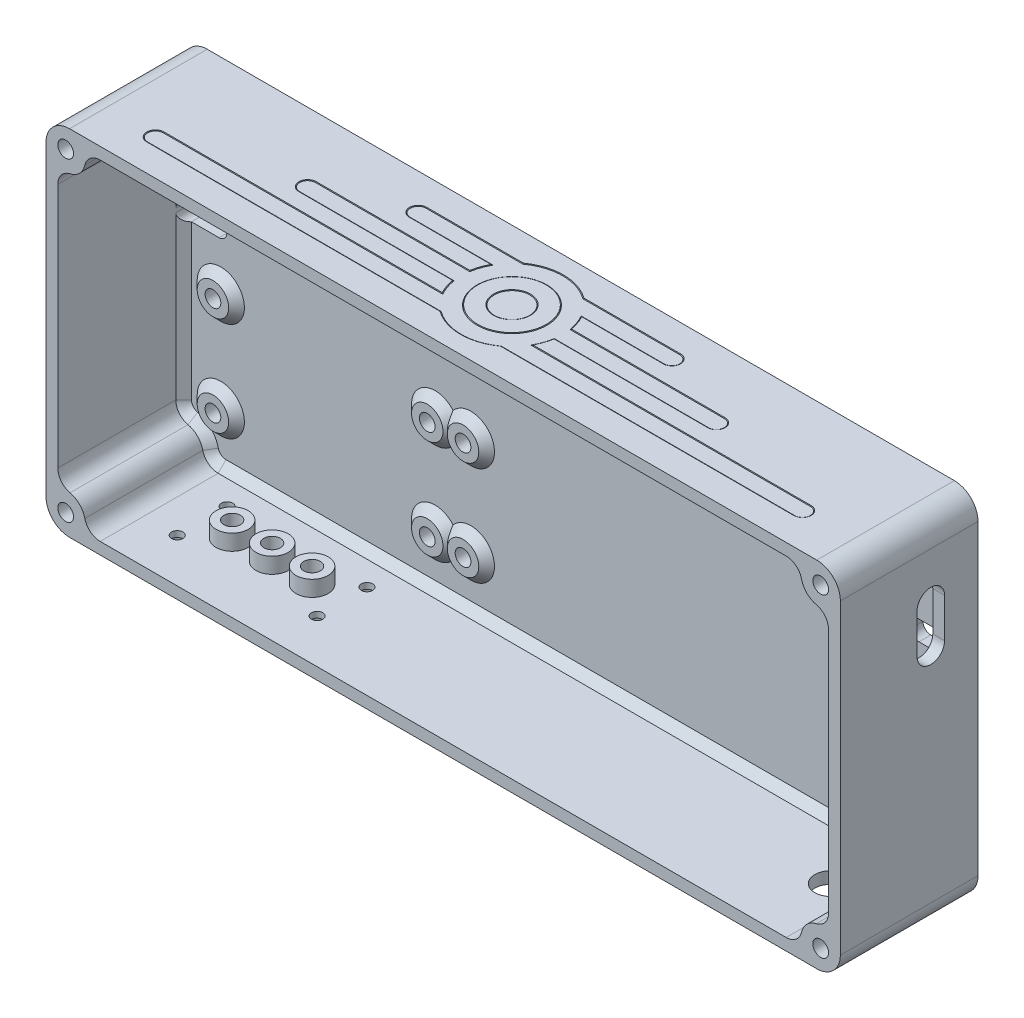
from build123d import *
from build123d.topology import SkipClean

# Parameters (mm, degrees)
ESQUISSE1_R                                        = 2
BOSS_EXTRU_1_DEPTH                                 = 35
COQUE1_T                                           = -3
ESQUISSE9_R                                        = 2
BOSS_EXTRU_3_DEPTH                                 = 25
ESQUISSE2_R                                        = 4
BOSS_EXTRU_2_DEPTH                                 = 2
ESQUISSE3_R                                        = 2
ENL_V_MAT_EXTRU_1_DEPTH                            = 115.568756649
ENL_V_MAT_EXTRU_2_REACH                            = 141.735
ESQUISSE4_R                                        = 4
ESQUISSE4_R_2                                      = 2.1
CHAMBRAGE_POUR_VIS_SIX_PANS_CREUX_M2_5_D           = 2.9
CHAMBRAGE_POUR_VIS_SIX_PANS_CREUX_M2_5_DEPTH       = 3
CHAMBRAGE_POUR_VIS_SIX_PANS_CREUX_M2_5_CBORE_D     = 5.5
CHAMBRAGE_POUR_VIS_SIX_PANS_CREUX_M2_5_CBORE_DEPTH = 1.5
ESQUISSE7_R                                        = 4.1
ESQUISSE7_R_2                                      = 2.1
EXTRU_MINCE1_DEPTH                                 = 4
CONG_1_R                                           = 4
CHANFREIN1_SIZE                                    = 2
ESQUISSE11_W                                       = 5.2
ESQUISSE11_H                                       = 5.2
ENL_V_MAT_EXTRU_5_DEPTH                            = 2.5
ESQUISSE8_W                                        = 11
ESQUISSE8_H                                        = 23
ESQUISSE8_W_2                                      = 196
ESQUISSE8_H_2                                      = 11
ENL_V_MAT_EXTRU_3_DEPTH                            = 2
ENL_V_MAT_EXTRU_4_REACH                            = 117.391
ESQUISSE10_W                                       = 11
ESQUISSE10_H                                       = 5
CONG_2_R                                           = 2
ESQUISSE15_R                                       = 4.7
ENL_V_MAT_EXTRU_7_DEPTH                            = 1.6
ESQUISSE16_R                                       = 8.9
BOSS_EXTRU_6_DEPTH                                 = 1.5
ESQUISSE16_R_2                                     = 4.5
BOSS_EXTRU_6_2_DEPTH                               = 1.5
ESQUISSE17_W                                       = 16.4
ESQUISSE17_H                                       = 16.4
ESQUISSE17_W_2                                     = 12.4
ESQUISSE17_H_2                                     = 12.4
ESQUISSE17_R                                       = 3.9
BOSS_EXTRU_7_DEPTH                                 = 2.3
BOSS_EXTRU_8_START                                 = 2.3
ESQUISSE17_3_W                                     = 16.4
ESQUISSE17_3_H                                     = 16.4
ESQUISSE17_3_W_2                                   = 12.4
ESQUISSE17_3_H_2                                   = 12.4
BOSS_EXTRU_8_DEPTH                                 = 3
ENL_V_START                                        = -1.4
ESQUISSE17_4_R                                     = 3.9
ENL_V_MAT_EXTRU_8_DEPTH                            = 1.4
ESQUISSE18_R                                       = 4.7
ENL_V_MAT_EXTRU_9_DEPTH                            = 2
CHANFREIN2_SIZE                                    = 5.3
BOSS_EXTRU_9_DEPTH                                 = 8.3
ENL_V_MAT_EXTRU_10_REACH                           = 123.416
ESQUISSE20_R                                       = 1
ENL_V_MAT_EXTRU_10_DIRECTION_2_REACH               = 123.416
ENL_V_MAT_EXTRU_11_DEPTH                           = 3


with BuildPart() as part:
    # Esquisse1 → Boss.-Extru.1 (new body)
    with BuildSketch(Plane.XY):
        with BuildLine():
            Line((-95, 45), (95, 45))
            ThreePointArc((95, 45), (99.242640687, 43.242640687), (101, 39))
            Line((101, 39), (101, -39))
            ThreePointArc((101, -39), (99.242640687, -43.242640687), (95, -45))
            Line((95, -45), (-95, -45))
            ThreePointArc((-95, -45), (-99.242640687, -43.242640687), (-101, -39))
            Line((-101, -39), (-101, 39))
            ThreePointArc((-101, 39), (-99.242640687, 43.242640687), (-95, 45))
        make_face()
        with Locations((-96, 40)):
            Circle(ESQUISSE1_R, mode=Mode.SUBTRACT)
        with Locations((-96, -40)):
            Circle(ESQUISSE1_R, mode=Mode.SUBTRACT)
        with Locations((96, 40)):
            Circle(ESQUISSE1_R, mode=Mode.SUBTRACT)
        with Locations((96, -40)):
            Circle(ESQUISSE1_R, mode=Mode.SUBTRACT)
    extrude(amount=BOSS_EXTRU_1_DEPTH)

    # Coque1
    coque1_openings = [part.faces().sort_by_distance(p)[0] for p in [
        (0, 0, 35),
    ]]
    offset(amount=COQUE1_T, openings=coque1_openings)

    # Esquisse9 → Boss.-Extru.3 (add)
    with BuildSketch(Plane(origin=(0, 0, 0), x_dir=(-1, 0, 0), z_dir=(0, 0, -1))):
        with Locations(Location((96, 40, 0), (0, 0, 180))):
            Circle(ESQUISSE9_R)
        with Locations(Location((96, -40, 0), (0, 0, 180))):
            Circle(ESQUISSE9_R)
        with Locations(Location((-96, -40, 0), (0, 0, 180))):
            Circle(ESQUISSE9_R)
        with Locations(Location((-96, 40, 0), (0, 0, 180))):
            Circle(ESQUISSE9_R)
    extrude(amount=-BOSS_EXTRU_3_DEPTH)

    # Esquisse2 → Boss.-Extru.2 (add)
    with BuildSketch(Plane.XY.offset(3)):
        with Locations((88.55, -29.4)):
            Circle(ESQUISSE2_R)
        with Locations((88.55, -4.2)):
            Circle(ESQUISSE2_R)
        with Locations((-24.95, -4.2)):
            Circle(ESQUISSE2_R)
        with Locations((-24.95, -29.4)):
            Circle(ESQUISSE2_R)
        with Locations((-34.05, -29.4)):
            Circle(ESQUISSE2_R)
        with Locations((-34.05, -4.2)):
            Circle(ESQUISSE2_R)
        with Locations((-88.55, -4.2)):
            Circle(ESQUISSE2_R)
        with Locations((-88.55, -29.4)):
            Circle(ESQUISSE2_R)
    extrude(amount=BOSS_EXTRU_2_DEPTH)

    # Esquisse3 → Enlèv. mat.-Extru.1 (cut, through all)
    with BuildSketch(Plane.XY.offset(5)):
        with Locations((88.55, -29.4)):
            Circle(ESQUISSE3_R)
        with Locations((88.55, -4.2)):
            Circle(ESQUISSE3_R)
        with Locations((-24.95, -4.2)):
            Circle(ESQUISSE3_R)
        with Locations((-24.95, -29.4)):
            Circle(ESQUISSE3_R)
        with Locations((-34.05, -29.4)):
            Circle(ESQUISSE3_R)
        with Locations((-88.55, -4.2)):
            Circle(ESQUISSE3_R)
        with Locations((-88.55, -29.4)):
            Circle(ESQUISSE3_R)
        with Locations((-34.05, -4.2)):
            Circle(ESQUISSE3_R)
    extrude(amount=-ENL_V_MAT_EXTRU_1_DEPTH, mode=Mode.SUBTRACT)

    # Esquisse4 → Enlèv. mat.-Extru.2 (cut, up to next)
    with BuildSketch(Plane.XZ.offset(45), mode=Mode.PRIVATE) as enl_v_mat_extru_2_sk1:
        with Locations(Location((81, 17.5, 0), (0, 0, 270))):
            Circle(ESQUISSE4_R)
    enl_v_mat_extru_2_tool1 = extrude(enl_v_mat_extru_2_sk1.sketch, amount=-ENL_V_MAT_EXTRU_2_REACH, mode=Mode.PRIVATE) & part.part
    # Esquisse4 → Enlèv. mat.-Extru.2 (cut, up to next)
    with BuildSketch(Plane.XZ.offset(45), mode=Mode.PRIVATE) as enl_v_mat_extru_2_sk2:
        with Locations(Location((-71.16, 17.5, 0), (0, 0, 270))):
            Circle(ESQUISSE4_R_2)
    enl_v_mat_extru_2_tool2 = extrude(enl_v_mat_extru_2_sk2.sketch, amount=-ENL_V_MAT_EXTRU_2_REACH, mode=Mode.PRIVATE) & part.part
    # Esquisse4 → Enlèv. mat.-Extru.2 (cut, up to next)
    with BuildSketch(Plane.XZ.offset(45), mode=Mode.PRIVATE) as enl_v_mat_extru_2_sk3:
        with Locations(Location((-61, 17.5, 0), (0, 0, 270))):
            Circle(ESQUISSE4_R_2)
    enl_v_mat_extru_2_tool3 = extrude(enl_v_mat_extru_2_sk3.sketch, amount=-ENL_V_MAT_EXTRU_2_REACH, mode=Mode.PRIVATE) & part.part
    # Esquisse4 → Enlèv. mat.-Extru.2 (cut, up to next)
    with BuildSketch(Plane.XZ.offset(45), mode=Mode.PRIVATE) as enl_v_mat_extru_2_sk4:
        with Locations(Location((-50.84, 17.5, 0), (0, 0, 270))):
            Circle(ESQUISSE4_R_2)
    enl_v_mat_extru_2_tool4 = extrude(enl_v_mat_extru_2_sk4.sketch, amount=-ENL_V_MAT_EXTRU_2_REACH, mode=Mode.PRIVATE) & part.part
    add(enl_v_mat_extru_2_tool1.solids().sort_by_distance((81, -45, 17.5))[0], mode=Mode.SUBTRACT)
    add(enl_v_mat_extru_2_tool2.solids().sort_by_distance((-71.16, -45, 17.5))[0], mode=Mode.SUBTRACT)
    add(enl_v_mat_extru_2_tool3.solids().sort_by_distance((-61, -45, 17.5))[0], mode=Mode.SUBTRACT)
    add(enl_v_mat_extru_2_tool4.solids().sort_by_distance((-50.84, -45, 17.5))[0], mode=Mode.SUBTRACT)

    # Chambrage pour vis à six pans creux M2.51
    with Locations(Plane(origin=(0, -45, 0), x_dir=(-1, 0, 0), z_dir=(0, -1, 0))):
        with Locations((78.78, -23.85), (78.78, -11.15), (43.22, -23.85), (43.22, -11.15)):
            CounterBoreHole(CHAMBRAGE_POUR_VIS_SIX_PANS_CREUX_M2_5_D / 2, CHAMBRAGE_POUR_VIS_SIX_PANS_CREUX_M2_5_CBORE_D / 2, CHAMBRAGE_POUR_VIS_SIX_PANS_CREUX_M2_5_CBORE_DEPTH, depth=CHAMBRAGE_POUR_VIS_SIX_PANS_CREUX_M2_5_DEPTH)

    # Esquisse7 → Extru.-Mince1 (add)
    # profile 1 of 3: a face of its own
    with SkipClean():  # the faces are left unmerged after this step: merging them gives an invalid solid
        with BuildSketch(Plane(origin=(0, -42, 0), x_dir=(1, 0, 0), z_dir=(0, 1, 0))):
            with Locations((-71.16, -17.5)):
                Circle(ESQUISSE7_R)
            with Locations((-71.16, -17.5)):
                Circle(ESQUISSE7_R_2, mode=Mode.SUBTRACT)
        # profile 2 of 3: a face of its own
        with BuildSketch(Plane(origin=(0, -42, 0), x_dir=(1, 0, 0), z_dir=(0, 1, 0))):
            with Locations((-61, -17.5)):
                Circle(ESQUISSE7_R)
            with Locations((-61, -17.5)):
                Circle(ESQUISSE7_R_2, mode=Mode.SUBTRACT)
        # profile 3 of 3: a face of its own
        with BuildSketch(Plane(origin=(0, -42, 0), x_dir=(1, 0, 0), z_dir=(0, 1, 0))):
            with Locations((-50.84, -17.5)):
                Circle(ESQUISSE7_R)
            with Locations((-50.84, -17.5)):
                Circle(ESQUISSE7_R_2, mode=Mode.SUBTRACT)
        extrude(amount=EXTRU_MINCE1_DEPTH)

    # Congé1
    cong_1_edges = [part.edges().sort_by_distance(p)[0] for p in [
        (98, 35.417424305, 19),
        (-91.417424305, 42, 19),
        (-98, -35.417424305, 19),
        (91.417424305, -42, 19),
        (-98, 35.417424305, 19),
        (-91.417424305, -42, 19),
        (91.417424305, 42, 19),
        (98, -35.417424305, 19),
    ]]
    fillet(cong_1_edges, radius=CONG_1_R)

    # Chanfrein1
    # the kernel refuses this chamfer: 2 mm, written as the material it adds along each edge
    with BuildSketch(Plane(origin=(-34.05, -4.2, 3), x_dir=(1, 0, 0), z_dir=(0, -1, 0))) as chanfrein1_piece_1_section:
        Polygon((4 + CHANFREIN1_SIZE, 0), (4, CHANFREIN1_SIZE), (4, 0), align=None)
    chanfrein1_piece_1 = revolve(axis=Axis((-34.05, -4.2, 3), (0, 0, 1)), mode=Mode.PRIVATE)
    chanfrein1_piece_1 = split(chanfrein1_piece_1, bisect_by=Plane(origin=(-39.049949525, -4.2, 5), z_dir=(0, 0, -1)), keep=Keep.TOP, mode=Mode.PRIVATE)
    add(chanfrein1_piece_1)
    with BuildSketch(Plane(origin=(-88.55, -4.2, 3), x_dir=(1, 0, 0), z_dir=(0, -1, 0))) as chanfrein1_piece_2_section:
        Polygon((4 + CHANFREIN1_SIZE, 0), (4, CHANFREIN1_SIZE), (4, 0), align=None)
    chanfrein1_piece_2 = revolve(axis=Axis((-88.55, -4.2, 3), (0, 0, 1)), mode=Mode.PRIVATE)
    chanfrein1_piece_2 = split(chanfrein1_piece_2, bisect_by=Plane(origin=(-93.549949528, -4.2, 5), z_dir=(0, 0, -1)), keep=Keep.TOP, mode=Mode.PRIVATE)
    add(chanfrein1_piece_2)
    with BuildSketch(Plane(origin=(-88.55, -29.4, 3), x_dir=(1, 0, 0), z_dir=(0, -1, 0))) as chanfrein1_piece_3_section:
        Polygon((4 + CHANFREIN1_SIZE, 0), (4, CHANFREIN1_SIZE), (4, 0), align=None)
    chanfrein1_piece_3 = revolve(axis=Axis((-88.55, -29.4, 3), (0, 0, 1)), mode=Mode.PRIVATE)
    chanfrein1_piece_3 = split(chanfrein1_piece_3, bisect_by=Plane(origin=(-93.549949525, -29.4, 5), z_dir=(0, 0, -1)), keep=Keep.TOP, mode=Mode.PRIVATE)
    add(chanfrein1_piece_3)
    with BuildSketch(Plane(origin=(-87.225035613, -42, 3), x_dir=(0, -0.027495876610585623, 0.9996219169112968), z_dir=(1, 0, 0)), Plane(origin=(87.225035613, 42, 3), x_dir=(0, 0.027495876610585623, 0.9996219169112968), z_dir=(-1, 0, 0))) as chanfrein1_piece_4:
        Polygon((CHANFREIN1_SIZE * 0.999621916911, -CHANFREIN1_SIZE * 0.0274958766106), (-CHANFREIN1_SIZE * 0.0274958766106, -CHANFREIN1_SIZE * 0.999621916911), (0, 0), align=None)
    extrude(amount=174.450071225)
    with BuildSketch(Plane(origin=(-96, -40, 3), x_dir=(0.974996043043569, 0.22222222222222282, 0), z_dir=(0.22222222222222282, -0.974996043043569, 0))) as chanfrein1_piece_5:
        Polygon((5, CHANFREIN1_SIZE), (5 + CHANFREIN1_SIZE, 0), (5, 0), align=None)
    revolve(axis=Axis((-96, -40, 3), (0, 0, 1)), revolution_arc=64.320823186)
    with BuildSketch(Plane(origin=(98, -31.225035613, 3), x_dir=(0.02749587661058907, 0, 0.9996219169112965), z_dir=(0, 1, 0)), Plane(origin=(-98, 31.225035613, 3), x_dir=(-0.02749587661058907, 0, 0.9996219169112965), z_dir=(0, -1, 0))) as chanfrein1_piece_6:
        Polygon((CHANFREIN1_SIZE * 0.999621916911, -CHANFREIN1_SIZE * 0.0274958766106), (-CHANFREIN1_SIZE * 0.0274958766106, -CHANFREIN1_SIZE * 0.999621916911), (0, 0), align=None)
    extrude(amount=62.450071225)
    with BuildSketch(Plane(origin=(96, 40, 3), x_dir=(-0.2222222222222174, -0.9749960430435702, 0), z_dir=(0.9749960430435702, -0.2222222222222174, 0))) as chanfrein1_piece_7:
        Polygon((5, -CHANFREIN1_SIZE), (5 + CHANFREIN1_SIZE, 0), (5, 0), align=None)
    revolve(axis=Axis((96, 40, 3), (0, 0, -1)), revolution_arc=64.320823186)
    with BuildSketch(Plane(origin=(-96, 40, 3), x_dir=(0.2222222222222285, -0.9749960430435676, 0), z_dir=(-0.9749960430435676, -0.2222222222222285, 0))) as chanfrein1_piece_8:
        Polygon((5, CHANFREIN1_SIZE), (5 + CHANFREIN1_SIZE, 0), (5, 0), align=None)
    revolve(axis=Axis((-96, 40, 3), (0, 0, 1)), revolution_arc=64.320823186)
    with BuildSketch(Plane(origin=(96, -40, 3), x_dir=(-0.9749960430435696, 0.2222222222222201, 0), z_dir=(-0.2222222222222201, -0.9749960430435696, 0))) as chanfrein1_piece_9:
        Polygon((5, -CHANFREIN1_SIZE), (5 + CHANFREIN1_SIZE, 0), (5, 0), align=None)
    revolve(axis=Axis((96, -40, 3), (0, 0, -1)), revolution_arc=64.320823186)
    with BuildSketch(Plane(origin=(-94, 31.225035613, 3), x_dir=(-0.2222222222222287, 0.9749960430435677, 0), z_dir=(0.9749960430435677, 0.2222222222222287, 0))) as chanfrein1_piece_10:
        Polygon((4, CHANFREIN1_SIZE), (4 - CHANFREIN1_SIZE, 0), (4, 0), align=None)
    revolve(axis=Axis((-94, 31.225035613, 3), (0, 0, 1)), revolution_arc=77.160411593)
    with BuildSketch(Plane(origin=(-87.225035613, 38, 3), x_dir=(0, 1, 0), z_dir=(1, 0, 0))) as chanfrein1_piece_11:
        Polygon((4, CHANFREIN1_SIZE), (4 - CHANFREIN1_SIZE, 0), (4, 0), align=None)
    revolve(axis=Axis((-87.225035613, 38, 3), (0, 0, 1)), revolution_arc=77.160411593)
    with BuildSketch(Plane(origin=(87.225035613, 38, 3), x_dir=(0.9749960430435685, 0.22222222222222512, 0), z_dir=(0.22222222222222512, -0.9749960430435685, 0))) as chanfrein1_piece_12:
        Polygon((4, CHANFREIN1_SIZE), (4 - CHANFREIN1_SIZE, 0), (4, 0), align=None)
    revolve(axis=Axis((87.225035613, 38, 3), (0, 0, 1)), revolution_arc=77.160411593)
    with BuildSketch(Plane(origin=(94, 31.225035613, 3), x_dir=(1, 0, 0), z_dir=(0, -1, 0))) as chanfrein1_piece_13:
        Polygon((4, CHANFREIN1_SIZE), (4 - CHANFREIN1_SIZE, 0), (4, 0), align=None)
    revolve(axis=Axis((94, 31.225035613, 3), (0, 0, 1)), revolution_arc=77.160411593)
    with BuildSketch(Plane(origin=(94, -31.225035613, 3), x_dir=(0.22222222222221782, -0.9749960430435702, 0), z_dir=(-0.9749960430435702, -0.22222222222221782, 0))) as chanfrein1_piece_14:
        Polygon((4, CHANFREIN1_SIZE), (4 - CHANFREIN1_SIZE, 0), (4, 0), align=None)
    revolve(axis=Axis((94, -31.225035613, 3), (0, 0, 1)), revolution_arc=77.160411593)
    with BuildSketch(Plane(origin=(87.225035613, -38, 3), x_dir=(0, -1, 0), z_dir=(-1, 0, 0))) as chanfrein1_piece_15:
        Polygon((4, CHANFREIN1_SIZE), (4 - CHANFREIN1_SIZE, 0), (4, 0), align=None)
    revolve(axis=Axis((87.225035613, -38, 3), (0, 0, 1)), revolution_arc=77.160411593)
    with BuildSketch(Plane(origin=(-94, -31.225035613, 3), x_dir=(-0.22222222222222834, -0.9749960430435678, 0), z_dir=(0.9749960430435678, -0.22222222222222834, 0))) as chanfrein1_piece_16:
        Polygon((4, -CHANFREIN1_SIZE), (4 - CHANFREIN1_SIZE, 0), (4, 0), align=None)
    revolve(axis=Axis((-94, -31.225035613, 3), (0, 0, -1)), revolution_arc=77.160411593)
    with BuildSketch(Plane(origin=(-87.225035613, -38, 3), x_dir=(-0.9749960430435689, -0.22222222222222346, 0), z_dir=(-0.22222222222222346, 0.9749960430435689, 0))) as chanfrein1_piece_17:
        Polygon((4, CHANFREIN1_SIZE), (4 - CHANFREIN1_SIZE, 0), (4, 0), align=None)
    revolve(axis=Axis((-87.225035613, -38, 3), (0, 0, 1)), revolution_arc=77.160411593)
    with BuildSketch(Plane(origin=(88.55, -4.2, 3), x_dir=(1, 0, 0), z_dir=(0, -1, 0))) as chanfrein1_piece_18_section:
        Polygon((4 + CHANFREIN1_SIZE, 0), (4, CHANFREIN1_SIZE), (4, 0), align=None)
    chanfrein1_piece_18 = revolve(axis=Axis((88.55, -4.2, 3), (0, 0, 1)), mode=Mode.PRIVATE)
    chanfrein1_piece_18 = split(chanfrein1_piece_18, bisect_by=Plane(origin=(83.550050474, -4.2, 5), z_dir=(0, 0, -1)), keep=Keep.TOP, mode=Mode.PRIVATE)
    add(chanfrein1_piece_18)
    with BuildSketch(Plane(origin=(-24.95, -4.2, 3), x_dir=(1, 0, 0), z_dir=(0, -1, 0))) as chanfrein1_piece_19_section:
        Polygon((4 + CHANFREIN1_SIZE, 0), (4, CHANFREIN1_SIZE), (4, 0), align=None)
    chanfrein1_piece_19 = revolve(axis=Axis((-24.95, -4.2, 3), (0, 0, 1)), mode=Mode.PRIVATE)
    chanfrein1_piece_19 = split(chanfrein1_piece_19, bisect_by=Plane(origin=(-29.949949525, -4.2, 5), z_dir=(0, 0, -1)), keep=Keep.TOP, mode=Mode.PRIVATE)
    add(chanfrein1_piece_19)
    with BuildSketch(Plane(origin=(-24.95, -29.4, 3), x_dir=(1, 0, 0), z_dir=(0, -1, 0))) as chanfrein1_piece_20_section:
        Polygon((4 + CHANFREIN1_SIZE, 0), (4, CHANFREIN1_SIZE), (4, 0), align=None)
    chanfrein1_piece_20 = revolve(axis=Axis((-24.95, -29.4, 3), (0, 0, 1)), mode=Mode.PRIVATE)
    chanfrein1_piece_20 = split(chanfrein1_piece_20, bisect_by=Plane(origin=(-29.949949525, -29.4, 5), z_dir=(0, 0, -1)), keep=Keep.TOP, mode=Mode.PRIVATE)
    add(chanfrein1_piece_20)
    with BuildSketch(Plane(origin=(88.55, -29.4, 3), x_dir=(1, 0, 0), z_dir=(0, -1, 0))) as chanfrein1_piece_21_section:
        Polygon((4 + CHANFREIN1_SIZE, 0), (4, CHANFREIN1_SIZE), (4, 0), align=None)
    chanfrein1_piece_21 = revolve(axis=Axis((88.55, -29.4, 3), (0, 0, 1)), mode=Mode.PRIVATE)
    chanfrein1_piece_21 = split(chanfrein1_piece_21, bisect_by=Plane(origin=(83.550050475, -29.4, 5), z_dir=(0, 0, -1)), keep=Keep.TOP, mode=Mode.PRIVATE)
    add(chanfrein1_piece_21)
    with BuildSketch(Plane(origin=(-34.05, -29.4, 3), x_dir=(1, 0, 0), z_dir=(0, -1, 0))) as chanfrein1_piece_22_section:
        Polygon((4 + CHANFREIN1_SIZE, 0), (4, CHANFREIN1_SIZE), (4, 0), align=None)
    chanfrein1_piece_22 = revolve(axis=Axis((-34.05, -29.4, 3), (0, 0, 1)), mode=Mode.PRIVATE)
    chanfrein1_piece_22 = split(chanfrein1_piece_22, bisect_by=Plane(origin=(-39.049949523, -29.4, 5), z_dir=(0, 0, -1)), keep=Keep.TOP, mode=Mode.PRIVATE)
    add(chanfrein1_piece_22)

    # Esquisse11 → Enlèv. mat.-Extru.5 (cut)
    with BuildSketch(Plane(origin=(0, 0, 0), x_dir=(-1, 0, 0), z_dir=(0, 0, -1))):
        with Locations((-81, 25)):
            Rectangle(ESQUISSE11_W, ESQUISSE11_H)
        with Locations((-81, -25)):
            Rectangle(ESQUISSE11_W, ESQUISSE11_H)
        with Locations((81, -25)):
            Rectangle(ESQUISSE11_W, ESQUISSE11_H)
        with Locations((81, 25)):
            Rectangle(ESQUISSE11_W, ESQUISSE11_H)
    extrude(amount=-ENL_V_MAT_EXTRU_5_DEPTH, mode=Mode.SUBTRACT)

    # Esquisse8 → Enlèv. mat.-Extru.3 (cut)
    with BuildSketch(Plane(origin=(0, 0, 0), x_dir=(-1, 0, 0), z_dir=(0, 0, -1))):
        with Locations((-92.5, 19.5)):
            Rectangle(ESQUISSE8_W, ESQUISSE8_H)
        with Locations((0, 36.5)):
            Rectangle(ESQUISSE8_W_2, ESQUISSE8_H_2)
        with Locations((92.5, 19.5)):
            Rectangle(ESQUISSE8_W, ESQUISSE8_H)
    extrude(amount=-ENL_V_MAT_EXTRU_3_DEPTH, mode=Mode.SUBTRACT)

    # Esquisse10 → Enlèv. mat.-Extru.4 (cut, up to next)
    with BuildSketch(Plane(origin=(0, 0, 2), x_dir=(-1, 0, 0), z_dir=(0, 0, -1)), mode=Mode.PRIVATE) as enl_v_mat_extru_4_sk1:
        with Locations((-92.5, 10.5)):
            Rectangle(ESQUISSE10_W, ESQUISSE10_H)
    enl_v_mat_extru_4_tool1 = extrude(enl_v_mat_extru_4_sk1.sketch, amount=-ENL_V_MAT_EXTRU_4_REACH, mode=Mode.PRIVATE) & part.part
    # Esquisse10 → Enlèv. mat.-Extru.4 (cut, up to next)
    with BuildSketch(Plane(origin=(0, 0, 2), x_dir=(-1, 0, 0), z_dir=(0, 0, -1)), mode=Mode.PRIVATE) as enl_v_mat_extru_4_sk2:
        with Locations((92.5, 10.5)):
            Rectangle(ESQUISSE10_W, ESQUISSE10_H)
    enl_v_mat_extru_4_tool2 = extrude(enl_v_mat_extru_4_sk2.sketch, amount=-ENL_V_MAT_EXTRU_4_REACH, mode=Mode.PRIVATE) & part.part
    add(enl_v_mat_extru_4_tool1.solids().sort_by_distance((92.5, 10.5, 2))[0], mode=Mode.SUBTRACT)
    add(enl_v_mat_extru_4_tool2.solids().sort_by_distance((-92.5, 10.5, 2))[0], mode=Mode.SUBTRACT)

    # Congé2
    cong_2_edges = [part.edges().sort_by_distance(p)[0] for p in [
        (-98, 8, 2.5),
        (-98, 13, 3.5),
        (-87, 13, 2.5),
        (-87, 8, 1.5),
        (-87, 31, 1),
        (-98, 42, 1),
        (98, 8, 2.5),
        (98, 13, 3.5),
        (87, 13, 2.5),
        (98, 42, 1),
        (87, 8, 1.5),
        (87, 31, 1),
    ]]
    fillet(cong_2_edges, radius=CONG_2_R)

    # Esquisse15 → Enlèv. mat.-Extru.7 (cut)
    with BuildSketch(Plane(origin=(0, 45, 0), x_dir=(1, 0, 0), z_dir=(0, 1, 0))):
        with BuildLine():
            Line((-2.264950331, -28.1), (-7.697402159, -28.1))
            ThreePointArc((-7.697402159, -28.1), (5.948698669, -29.17146024), (13.1, -17.5))
            ThreePointArc((13.1, -17.5), (5.948698669, -5.82853976), (-7.697402159, -6.9))
            Line((-7.697402159, -6.9), (-2.264950331, -6.9))
            ThreePointArc((-2.264950331, -6.9), (-0.819107483, -7.44182677), (-0.085443145, -8.800419581))
            ThreePointArc((-0.085443145, -8.800419581), (6.121545746, -11.318036098), (8.7, -17.5))
            ThreePointArc((8.7, -17.5), (6.121545746, -23.681963902), (-0.085443145, -26.199580419))
            ThreePointArc((-0.085443145, -26.199580419), (-0.819107483, -27.55817323), (-2.264950331, -28.1))
        make_face()
        with BuildLine():
            Line((-6.103277808, -23.7), (-11.539930676, -23.7))
            ThreePointArc((-11.539930676, -23.7), (-9.867053443, -26.11691687), (-7.697402159, -28.1))
            Line((-7.697402159, -28.1), (-2.264950331, -28.1))
            ThreePointArc((-2.264950331, -28.1), (-0.819107483, -27.55817323), (-0.085443145, -26.199580419))
            ThreePointArc((-0.085443145, -26.199580419), (-3.337220749, -25.534485526), (-6.103277808, -23.7))
        make_face()
        with BuildLine():
            ThreePointArc((-7.697402159, -28.1), (-9.867053443, -26.11691687), (-11.539930676, -23.7))
            Line((-11.539930676, -23.7), (-82.264950331, -23.7))
            ThreePointArc((-82.264950331, -23.7), (-84.464950331, -25.9), (-82.264950331, -28.1))
            Line((-82.264950331, -28.1), (-7.697402159, -28.1))
        make_face()
        with BuildLine():
            ThreePointArc((-8.42183908, -19.682344268), (-8.560639656, -19.69558163), (-8.7, -19.7))
            Line((-8.7, -19.7), (-12.91394595, -19.7))
            ThreePointArc((-12.91394595, -19.7), (-12.389431807, -21.755817136), (-11.539930676, -23.7))
            Line((-11.539930676, -23.7), (-6.103277808, -23.7))
            ThreePointArc((-6.103277808, -23.7), (-7.535260085, -21.84854636), (-8.42183908, -19.682344268))
        make_face()
        with BuildLine():
            Line((-51.978521026, -19.7), (-12.91394595, -19.7))
            ThreePointArc((-12.91394595, -19.7), (-13.1, -17.5), (-12.91394595, -15.3))
            Line((-12.91394595, -15.3), (-51.978521026, -15.3))
            ThreePointArc((-51.978521026, -15.3), (-54.178521026, -17.5), (-51.978521026, -19.7))
        make_face()
        with BuildLine():
            Line((-12.91394595, -19.7), (-8.7, -19.7))
            ThreePointArc((-8.7, -19.7), (-8.560639656, -19.69558163), (-8.42183908, -19.682344268))
            ThreePointArc((-8.42183908, -19.682344268), (-8.7, -17.5), (-8.42183908, -15.317655732))
            ThreePointArc((-8.42183908, -15.317655732), (-8.560639656, -15.30441837), (-8.7, -15.3))
            Line((-8.7, -15.3), (-12.91394595, -15.3))
            ThreePointArc((-12.91394595, -15.3), (-13.1, -17.5), (-12.91394595, -19.7))
        make_face()
        with BuildLine():
            ThreePointArc((-11.539930676, -11.3), (-12.389431807, -13.244182864), (-12.91394595, -15.3))
            Line((-12.91394595, -15.3), (-8.7, -15.3))
            ThreePointArc((-8.7, -15.3), (-8.560639656, -15.30441837), (-8.42183908, -15.317655732))
            ThreePointArc((-8.42183908, -15.317655732), (-7.535260085, -13.15145364), (-6.103277808, -11.3))
            Line((-6.103277808, -11.3), (-11.539930676, -11.3))
        make_face()
        with BuildLine():
            ThreePointArc((-7.697402159, -6.9), (-9.867053443, -8.88308313), (-11.539930676, -11.3))
            Line((-11.539930676, -11.3), (-6.103277808, -11.3))
            ThreePointArc((-6.103277808, -11.3), (-3.337220749, -9.465514474), (-0.085443145, -8.800419581))
            ThreePointArc((-0.085443145, -8.800419581), (-0.819107483, -7.44182677), (-2.264950331, -6.9))
            Line((-2.264950331, -6.9), (-7.697402159, -6.9))
        make_face()
        with BuildLine():
            Line((-32.264950331, -11.3), (-11.539930676, -11.3))
            ThreePointArc((-11.539930676, -11.3), (-9.867053443, -8.88308313), (-7.697402159, -6.9))
            Line((-7.697402159, -6.9), (-32.264950331, -6.9))
            ThreePointArc((-32.264950331, -6.9), (-34.464950331, -9.1), (-32.264950331, -11.3))
        make_face()
        with Locations(Location((0, -17.5, 0), (0, 0, 270))):
            Circle(ESQUISSE15_R)
    enl_v_mat_extru_7 = extrude(amount=-ENL_V_MAT_EXTRU_7_DEPTH, mode=Mode.SUBTRACT)

    # Symétrie1: Enlèv. mat.-Extru.7 across plane
    add(enl_v_mat_extru_7.mirror(Plane(origin=(0, 0, 0), x_dir=(0, 0, 1), z_dir=(1, 0, 0))), mode=Mode.SUBTRACT)

    # Esquisse17 → Boss.-Extru.7 (add)
    # profile 1 of 2: a face of its own
    with BuildSketch(Plane.XZ.offset(-42)):
        with Locations((0, 17.5)):
            Rectangle(ESQUISSE17_W, ESQUISSE17_H)
        with Locations((0, 17.5)):
            Rectangle(ESQUISSE17_W_2, ESQUISSE17_H_2, mode=Mode.SUBTRACT)
    # profile 2 of 2: a face of its own
    with BuildSketch(Plane.XZ.offset(-42)):
        with Locations((0, 17.5)):
            Rectangle(ESQUISSE17_W_2, ESQUISSE17_H_2)
        with Locations(Location((0, 17.5, 0), (0, 0, 270))):
            Circle(ESQUISSE17_R, mode=Mode.SUBTRACT)
    extrude(amount=BOSS_EXTRU_7_DEPTH)

    # Esquisse17<3> → Boss.-Extru.8 (add)
    with BuildSketch(Plane.XZ.offset(-42).offset(BOSS_EXTRU_8_START)):
        with Locations((0, 17.5)):
            Rectangle(ESQUISSE17_3_W, ESQUISSE17_3_H)
        with Locations((0, 17.5)):
            Rectangle(ESQUISSE17_3_W_2, ESQUISSE17_3_H_2, mode=Mode.SUBTRACT)
    extrude(amount=BOSS_EXTRU_8_DEPTH)

    # Esquisse17<4> → Enlèv. mat.-Extru.8 (cut)
    with BuildSketch(Plane.XZ.offset(-42).offset(ENL_V_START)):
        with Locations(Location((0, 17.5, 0), (0, 0, 90))):
            Circle(ESQUISSE17_4_R)
    extrude(amount=ENL_V_MAT_EXTRU_8_DEPTH, mode=Mode.SUBTRACT)

    # Esquisse18 → Enlèv. mat.-Extru.9 (cut)
    with BuildSketch(Plane.XZ.offset(-43.4)):
        with Locations(Location((0, 17.5, 0), (0, 0, 90))):
            Circle(ESQUISSE18_R)
    extrude(amount=ENL_V_MAT_EXTRU_9_DEPTH, mode=Mode.SUBTRACT)

    # Chanfrein2
    # the kernel refuses this chamfer: 5.3 mm, written as the material it adds along each edge
    with BuildSketch(Plane(origin=(-8.2, 42, 9.3), x_dir=(-0.9996219169112966, 0.02749587661058816, 0), z_dir=(0, 0, 1))) as chanfrein2_piece_1_section:
        Polygon((CHANFREIN2_SIZE * 0.999621916911, CHANFREIN2_SIZE * 0.0274958766106), (-CHANFREIN2_SIZE * 0.0274958766106, CHANFREIN2_SIZE * 0.999621916911), (0, 0), align=None)
    chanfrein2_piece_1 = extrude(amount=16.4, mode=Mode.PRIVATE)
    chanfrein2_piece_1 = split(chanfrein2_piece_1, bisect_by=Plane(origin=(-9.951142018, 36.7, 17.5), z_dir=(0, 1, 0)), keep=Keep.TOP, mode=Mode.PRIVATE)
    add(chanfrein2_piece_1)
    with BuildSketch(Plane(origin=(-8.2, 42, 25.7), x_dir=(0, 0.027495876610588166, 0.9996219169112966), z_dir=(1, 0, 0))) as chanfrein2_piece_2_section:
        Polygon((CHANFREIN2_SIZE * 0.999621916911, CHANFREIN2_SIZE * 0.0274958766106), (-CHANFREIN2_SIZE * 0.0274958766106, CHANFREIN2_SIZE * 0.999621916911), (0, 0), align=None)
    chanfrein2_piece_2 = extrude(amount=16.4, mode=Mode.PRIVATE)
    chanfrein2_piece_2 = split(chanfrein2_piece_2, bisect_by=Plane(origin=(0, 36.7, 27.451142018), z_dir=(0, 1, 0)), keep=Keep.TOP, mode=Mode.PRIVATE)
    add(chanfrein2_piece_2)
    with BuildSketch(Plane(origin=(8.2, 42, 25.7), x_dir=(0.9996219169112966, 0.027495876610588176, 0), z_dir=(0, 0, -1))) as chanfrein2_piece_3_section:
        Polygon((CHANFREIN2_SIZE * 0.999621916911, CHANFREIN2_SIZE * 0.0274958766106), (-CHANFREIN2_SIZE * 0.0274958766106, CHANFREIN2_SIZE * 0.999621916911), (0, 0), align=None)
    chanfrein2_piece_3 = extrude(amount=16.4, mode=Mode.PRIVATE)
    chanfrein2_piece_3 = split(chanfrein2_piece_3, bisect_by=Plane(origin=(9.951142018, 36.7, 17.5), z_dir=(0, 1, 0)), keep=Keep.TOP, mode=Mode.PRIVATE)
    add(chanfrein2_piece_3)
    with BuildSketch(Plane(origin=(-21.829919836, 42, 25.7), x_dir=(0, 0.027495876610586865, 0.9996219169112966), z_dir=(1, 0, 0))) as chanfrein2_piece_4a_section:
        Polygon((CHANFREIN2_SIZE * 0.999621916911, CHANFREIN2_SIZE * 0.0274958766106), (-CHANFREIN2_SIZE * 0.0274958766106, CHANFREIN2_SIZE * 0.999621916911), (0, 0), align=None)
    chanfrein2_piece_4a = extrude(amount=30.029919836, mode=Mode.PRIVATE)
    chanfrein2_piece_4a = split(chanfrein2_piece_4a, bisect_by=Plane(origin=(-8.2, 40.258238031, 27.451142018), z_dir=(-1, 0, 0)), keep=Keep.TOP, mode=Mode.PRIVATE)
    chanfrein2_piece_4a = split(chanfrein2_piece_4a, bisect_by=Plane(origin=(-15.014959918, 36.7, 27.451142018), z_dir=(0, 1, 0)), keep=Keep.TOP, mode=Mode.PRIVATE)
    with BuildSketch(Plane(origin=(-8.2, 42, 9.3), x_dir=(-0.9996219169112966, 0.02749587661058816, 0), z_dir=(0, 0, 1))) as chanfrein2_piece_4b_section:
        Polygon((CHANFREIN2_SIZE * 0.999621916911, CHANFREIN2_SIZE * 0.0274958766106), (-CHANFREIN2_SIZE * 0.0274958766106, CHANFREIN2_SIZE * 0.999621916911), (0, 0), align=None)
    chanfrein2_piece_4b = extrude(amount=30.029919836, mode=Mode.PRIVATE)
    chanfrein2_piece_4b = split(chanfrein2_piece_4b, bisect_by=Plane(origin=(-9.951142018, 40.258238031, 35), z_dir=(0, 0, -1)), keep=Keep.TOP, mode=Mode.PRIVATE)
    chanfrein2_piece_4b = split(chanfrein2_piece_4b, bisect_by=Plane(origin=(-9.951142018, 40.258238031, 25.7), z_dir=(0, 0, 1)), keep=Keep.TOP, mode=Mode.PRIVATE)
    chanfrein2_piece_4b = split(chanfrein2_piece_4b, bisect_by=Plane(origin=(-9.951142018, 36.7, 30.35), z_dir=(0, 1, 0)), keep=Keep.TOP, mode=Mode.PRIVATE)
    chanfrein2_piece_4 = chanfrein2_piece_4a & chanfrein2_piece_4b
    add(chanfrein2_piece_4)
    with BuildSketch(Plane(origin=(-8.2, 42, 25.7), x_dir=(0, 0.027495876610588166, 0.9996219169112966), z_dir=(1, 0, 0))) as chanfrein2_piece_5a_section:
        Polygon((CHANFREIN2_SIZE * 0.999621916911, CHANFREIN2_SIZE * 0.0274958766106), (-CHANFREIN2_SIZE * 0.0274958766106, CHANFREIN2_SIZE * 0.999621916911), (0, 0), align=None)
    chanfrein2_piece_5a = extrude(amount=30.029919836, mode=Mode.PRIVATE)
    chanfrein2_piece_5a = split(chanfrein2_piece_5a, bisect_by=Plane(origin=(8.2, 40.258238031, 27.451142018), z_dir=(1, 0, 0)), keep=Keep.TOP, mode=Mode.PRIVATE)
    chanfrein2_piece_5a = split(chanfrein2_piece_5a, bisect_by=Plane(origin=(15.014959918, 36.7, 27.451142018), z_dir=(0, 1, 0)), keep=Keep.TOP, mode=Mode.PRIVATE)
    with BuildSketch(Plane(origin=(8.2, 42, 39.329919836), x_dir=(0.9996219169112966, 0.02749587661058687, 0), z_dir=(0, 0, -1))) as chanfrein2_piece_5b_section:
        Polygon((CHANFREIN2_SIZE * 0.999621916911, CHANFREIN2_SIZE * 0.0274958766106), (-CHANFREIN2_SIZE * 0.0274958766106, CHANFREIN2_SIZE * 0.999621916911), (0, 0), align=None)
    chanfrein2_piece_5b = extrude(amount=30.029919836, mode=Mode.PRIVATE)
    chanfrein2_piece_5b = split(chanfrein2_piece_5b, bisect_by=Plane(origin=(9.951142018, 40.258238031, 35), z_dir=(0, 0, -1)), keep=Keep.TOP, mode=Mode.PRIVATE)
    chanfrein2_piece_5b = split(chanfrein2_piece_5b, bisect_by=Plane(origin=(9.951142018, 40.258238031, 25.7), z_dir=(0, 0, 1)), keep=Keep.TOP, mode=Mode.PRIVATE)
    chanfrein2_piece_5b = split(chanfrein2_piece_5b, bisect_by=Plane(origin=(9.951142018, 36.7, 30.35), z_dir=(0, 1, 0)), keep=Keep.TOP, mode=Mode.PRIVATE)
    chanfrein2_piece_5 = chanfrein2_piece_5a & chanfrein2_piece_5b
    add(chanfrein2_piece_5)

    # Esquisse19 → Boss.-Extru.9 (add)
    with BuildSketch(Plane.XY.offset(11.3)):
        Polygon((13.5, 42), (-13.5, 42), (-8.2, 36.7), (8.2, 36.7), align=None)
    extrude(amount=-BOSS_EXTRU_9_DEPTH)

    # Enlèv. mat.-Extru.10: up to this plane
    enl_v_mat_extru_10_end = Plane(origin=(-8.2, 36.7, 0), z_dir=(0.7071067811865438, 0.7071067811865512, 0))
    # Esquisse20 → Enlèv. mat.-Extru.10 (cut, up to the surface)
    with BuildSketch(Plane(origin=(-6.2, 0, 0), x_dir=(0, 0, -1), z_dir=(1, 0, 0)), mode=Mode.PRIVATE) as enl_v_mat_extru_10_sk1:
        with Locations((-20, 36.7)):
            Circle(ESQUISSE20_R)
    enl_v_mat_extru_10_tool1 = split(extrude(enl_v_mat_extru_10_sk1.sketch, amount=-ENL_V_MAT_EXTRU_10_REACH, mode=Mode.PRIVATE), bisect_by=enl_v_mat_extru_10_end, keep=Keep.BOTH, mode=Mode.PRIVATE)
    add(enl_v_mat_extru_10_tool1.solids().sort_by_distance((-6.2, 36.7, 20))[0], mode=Mode.SUBTRACT)
    # Esquisse20 → Enlèv. mat.-Extru.10 (cut, up to the surface)
    with BuildSketch(Plane(origin=(-6.2, 0, 0), x_dir=(0, 0, -1), z_dir=(1, 0, 0)), mode=Mode.PRIVATE) as enl_v_mat_extru_10_sk2:
        with Locations((-15, 36.7)):
            Circle(ESQUISSE20_R)
    enl_v_mat_extru_10_tool2 = split(extrude(enl_v_mat_extru_10_sk2.sketch, amount=-ENL_V_MAT_EXTRU_10_REACH, mode=Mode.PRIVATE), bisect_by=enl_v_mat_extru_10_end, keep=Keep.BOTH, mode=Mode.PRIVATE)
    add(enl_v_mat_extru_10_tool2.solids().sort_by_distance((-6.2, 36.7, 15))[0], mode=Mode.SUBTRACT)

    # Enlèv. mat.-Extru.10 direction 2: up to this plane
    enl_v_mat_extru_10_direction_2_end = Plane(origin=(13.5, 42, 35), z_dir=(0.7071067811865438, -0.7071067811865513, 0))
    # Esquisse20 → Enlèv. mat.-Extru.10 direction 2 (cut, up to the surface)
    with BuildSketch(Plane(origin=(-6.2, 0, 0), x_dir=(0, 0, -1), z_dir=(1, 0, 0)), mode=Mode.PRIVATE) as enl_v_mat_extru_10_direction_2_sk1:
        with Locations((-20, 36.7)):
            Circle(ESQUISSE20_R)
    enl_v_mat_extru_10_direction_2_tool1 = split(extrude(enl_v_mat_extru_10_direction_2_sk1.sketch, amount=ENL_V_MAT_EXTRU_10_DIRECTION_2_REACH, mode=Mode.PRIVATE), bisect_by=enl_v_mat_extru_10_direction_2_end, keep=Keep.BOTH, mode=Mode.PRIVATE)
    add(enl_v_mat_extru_10_direction_2_tool1.solids().sort_by_distance((-6.2, 36.7, 20))[0], mode=Mode.SUBTRACT)
    # Esquisse20 → Enlèv. mat.-Extru.10 direction 2 (cut, up to the surface)
    with BuildSketch(Plane(origin=(-6.2, 0, 0), x_dir=(0, 0, -1), z_dir=(1, 0, 0)), mode=Mode.PRIVATE) as enl_v_mat_extru_10_direction_2_sk2:
        with Locations((-15, 36.7)):
            Circle(ESQUISSE20_R)
    enl_v_mat_extru_10_direction_2_tool2 = split(extrude(enl_v_mat_extru_10_direction_2_sk2.sketch, amount=ENL_V_MAT_EXTRU_10_DIRECTION_2_REACH, mode=Mode.PRIVATE), bisect_by=enl_v_mat_extru_10_direction_2_end, keep=Keep.BOTH, mode=Mode.PRIVATE)
    add(enl_v_mat_extru_10_direction_2_tool2.solids().sort_by_distance((-6.2, 36.7, 15))[0], mode=Mode.SUBTRACT)

    # Esquisse21 → Enlèv. mat.-Extru.11 (cut)
    with BuildSketch(Plane(origin=(101, 0, 0), x_dir=(0, 0, -1), z_dir=(1, 0, 0))):
        with BuildLine():
            Line((-15.5, 17), (-15.5, 27))
            ThreePointArc((-15.5, 27), (-12, 30.5), (-8.5, 27))
            Line((-8.5, 27), (-8.5, 17))
            ThreePointArc((-8.5, 17), (-12, 13.5), (-15.5, 17))
        make_face()
    extrude(amount=-ENL_V_MAT_EXTRU_11_DEPTH, mode=Mode.SUBTRACT)


with BuildPart() as body_2:
    # Esquisse16 → Boss.-Extru.6 (new body)
    with BuildSketch(Plane(origin=(0, 43.4, 0), x_dir=(1, 0, 0), z_dir=(0, 1, 0))):
        with BuildLine():
            Line((-12.744018205, -15.5), (-51.978521026, -15.5))
            ThreePointArc((-51.978521026, -15.5), (-53.978521026, -17.5), (-51.978521026, -19.5))
            Line((-51.978521026, -19.5), (-12.744018205, -19.5))
            ThreePointArc((-12.744018205, -19.5), (-12.17268855, -21.770322407), (-11.20044642, -23.9))
            Line((-11.20044642, -23.9), (-82.264950331, -23.9))
            ThreePointArc((-82.264950331, -23.9), (-84.264950331, -25.9), (-82.264950331, -27.9))
            Line((-82.264950331, -27.9), (-7.632168761, -27.9))
            ThreePointArc((-7.632168761, -27.9), (0, -30.4), (7.632168761, -27.9))
            Line((7.632168761, -27.9), (82.264950331, -27.9))
            ThreePointArc((82.264950331, -27.9), (84.264950331, -25.9), (82.264950331, -23.9))
            Line((82.264950331, -23.9), (11.20044642, -23.9))
            ThreePointArc((11.20044642, -23.9), (12.17268855, -21.770322407), (12.744018205, -19.5))
            Line((12.744018205, -19.5), (51.978521026, -19.5))
            ThreePointArc((51.978521026, -19.5), (53.978521026, -17.5), (51.978521026, -15.5))
            Line((51.978521026, -15.5), (12.744018205, -15.5))
            ThreePointArc((12.744018205, -15.5), (12.17268855, -13.229677593), (11.20044642, -11.1))
            Line((11.20044642, -11.1), (32.264950331, -11.1))
            ThreePointArc((32.264950331, -11.1), (34.264950331, -9.1), (32.264950331, -7.1))
            Line((32.264950331, -7.1), (7.632168761, -7.1))
            ThreePointArc((7.632168761, -7.1), (0, -4.6), (-7.632168761, -7.1))
            Line((-7.632168761, -7.1), (-32.264950331, -7.1))
            ThreePointArc((-32.264950331, -7.1), (-34.264950331, -9.1), (-32.264950331, -11.1))
            Line((-32.264950331, -11.1), (-11.20044642, -11.1))
            ThreePointArc((-11.20044642, -11.1), (-12.17268855, -13.229677593), (-12.744018205, -15.5))
        make_face()
        with Locations(Location((0, -17.5, 0), (0, 0, 270))):
            Circle(ESQUISSE16_R, mode=Mode.SUBTRACT)
    extrude(amount=BOSS_EXTRU_6_DEPTH)


with BuildPart() as body_3:
    # Esquisse16 → Boss.-Extru.6 2 (new body)
    with BuildSketch(Plane(origin=(0, 43.4, 0), x_dir=(1, 0, 0), z_dir=(0, 1, 0))):
        with Locations(Location((0, -17.5, 0), (0, 0, 270))):
            Circle(ESQUISSE16_R_2)
    extrude(amount=BOSS_EXTRU_6_2_DEPTH)


solid = Compound([part.part, body_2.part, body_3.part])
